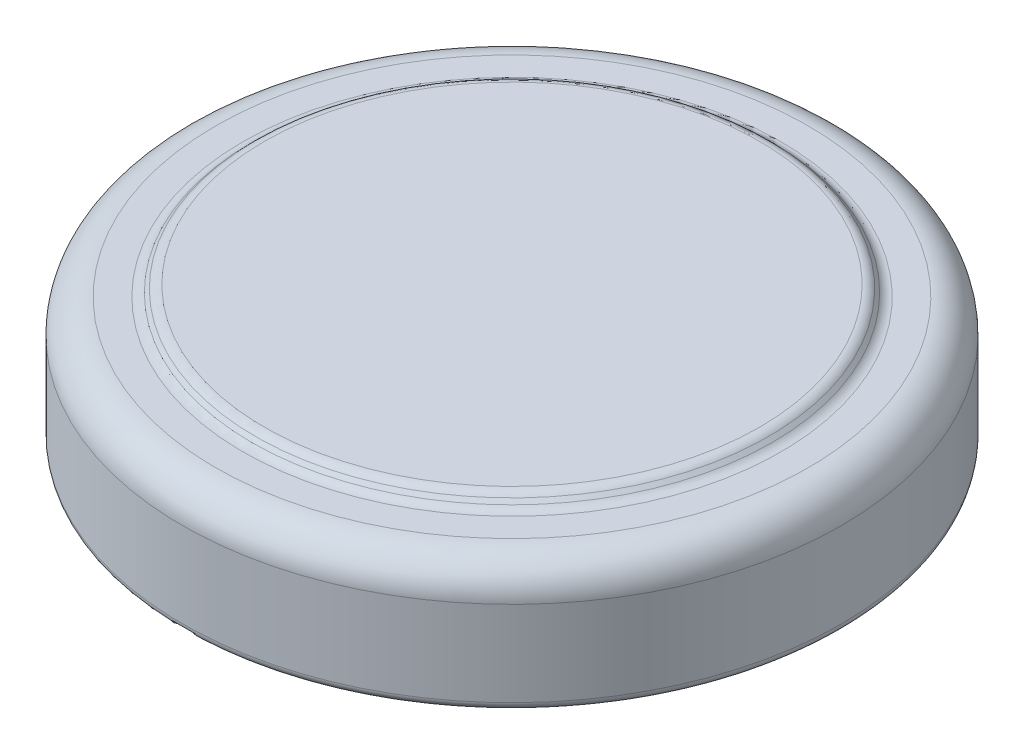
from build123d import *


with BuildPart() as part:
    # Sketch1 → Revolve1 (revolve)
    with BuildSketch(Plane.XY):
        with BuildLine():
            Line((0, 0), (-3.85, 0))
            ThreePointArc((-3.85, 0), (-3.920710678, 0.029289322), (-3.95, 0.1))
            Line((-3.95, 0.1), (-3.95, 1.12))
            ThreePointArc((-3.95, 1.12), (-3.832842712, 1.402842712), (-3.55, 1.52))
            Line((-3.55, 1.52), (-3.222132034, 1.52))
            ThreePointArc((-3.222132034, 1.52), (-3.16472952, 1.53141807), (-3.116066017, 1.563933983))
            Line((-3.116066017, 1.563933983), (-3.073933983, 1.606066017))
            ThreePointArc((-3.073933983, 1.606066017), (-3.02527048, 1.63858193), (-2.967867966, 1.65))
            Line((-2.967867966, 1.65), (0, 1.65))
            Line((0, 1.65), (0, 0))
        make_face()
    revolve(axis=Axis((0, 1.65, 0), (0, -1, 0)))


solid = part.part
